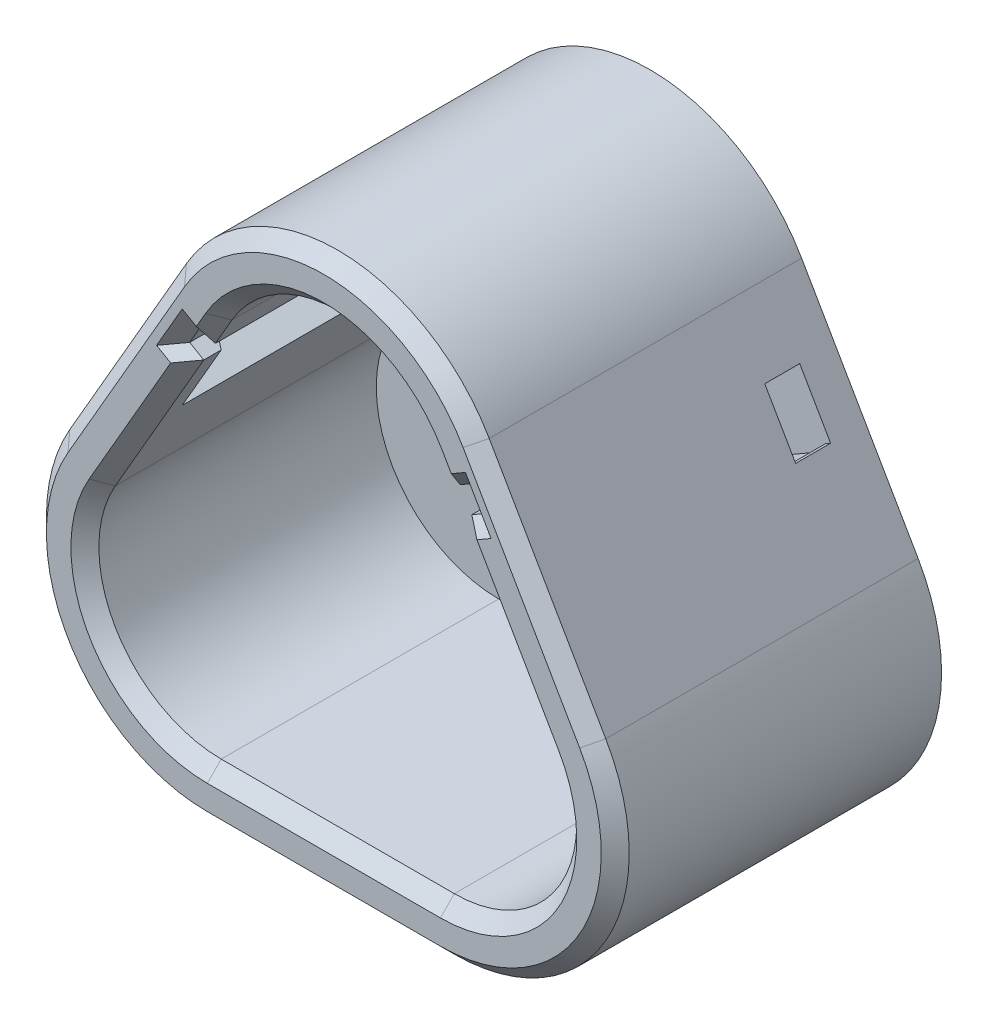
from build123d import *

# Parameters (mm, degrees)
BOSS_EXTRU_1_DEPTH      = 25
ENL_V_MAT_EXTRU_1_DEPTH = 20
ENL_V_MAT_EXTRU_2_DEPTH = 45.21248121115924
ENL_V_MAT_EXTRU_4_DEPTH = 20
ENL_V_MAT_EXTRU_3_DEPTH = 45.21248121115924
CHANFREIN1_SIZE         = 1.2
BOSS_EXTRU_2_START      = 3
BOSS_EXTRU_2_DEPTH      = 3
ENL_V_MAT_EXTRU_5_REACH = 47.001
ESQUISSE7_W             = 1.399999999999995
ESQUISSE7_H             = 20
CHANFREIN2_SIZE2        = 4
CHANFREIN2_SIZE         = 2.309401077
ENL_V_MAT_EXTRU_6_REACH = 60.237
CHANFREIN3_SIZE2        = 4
CHANFREIN3_SIZE         = 2.309401077


with BuildPart() as part:
    # Esquisse1 → Boss.-Extru.1 (new body)
    with BuildSketch(Plane.XY):
        with BuildLine():
            Line((-22.99038105676658, 1.7264973081037391), (-12.990381056766578, 19.047005383792516))
            ThreePointArc((-12.990381056766578, 19.047005383792516), (9.5e-16, 26.547005383792516), (12.990381056766578, 19.047005383792513))
            Line((12.990381056766578, 19.047005383792513), (22.990381056766577, 1.726497308103746))
            ThreePointArc((22.990381056766577, 1.726497308103746), (22.99038105676658, -13.273502691896258), (9.999999999999996, -20.77350269189626))
            Line((9.999999999999996, -20.77350269189626), (-10, -20.773502691896258))
            ThreePointArc((-10, -20.773502691896258), (-22.99038105676658, -13.273502691896255), (-22.99038105676658, 1.7264973081037391))
        make_face()
        with BuildLine():
            Line((-18.66025403784439, -0.7735026918962613), (-8.66025403784439, 16.547005383792516))
            ThreePointArc((-8.66025403784439, 16.547005383792516), (-2.69e-15, 21.547005383792516), (8.660254037844384, 16.547005383792516))
            Line((8.660254037844384, 16.547005383792516), (18.660254037844386, -0.7735026918962474))
            ThreePointArc((18.660254037844386, -0.7735026918962474), (18.660254037844393, -10.773502691896258), (10, -15.773502691896258))
            Line((10, -15.773502691896258), (-10, -15.773502691896258))
            ThreePointArc((-10, -15.773502691896258), (-18.66025403784439, -10.773502691896262), (-18.66025403784439, -0.7735026918962613))
        make_face(mode=Mode.SUBTRACT)
    extrude(amount=BOSS_EXTRU_1_DEPTH)

    # Esquisse2 → Enlèv. mat.-Extru.1 (cut)
    with BuildSketch(Plane.XY.offset(25)):
        Polygon((-10.914359353944898, 12.642780450695335), (-12.300000000000002, 13.442780450695334), (-11.600000000000003, 14.655216015993549), (-10.2143593539449, 13.855216015993548), align=None)
        Polygon((10.214359353944896, 13.855216015993548), (11.6, 14.655216015993549), (12.299999999999999, 13.442780450695334), (10.914359353944896, 12.642780450695334), align=None)
    extrude(amount=-ENL_V_MAT_EXTRU_1_DEPTH, mode=Mode.SUBTRACT)

    # Esquisse3 → Enlèv. mat.-Extru.2 (cut, through all)
    with BuildSketch(Plane.XY.offset(25)):
        Polygon((-10.064359353944898, 14.115023637128878), (-11.709807621135333, 15.06502363712888), (-12.709807621135335, 13.332972829560003), (-11.064359353944898, 12.382972829560003), align=None)
    enl_v_mat_extru_2 = extrude(amount=-ENL_V_MAT_EXTRU_2_DEPTH, mode=Mode.SUBTRACT)

    # Symétrie1: Enlèv. mat.-Extru.2 across plane
    add(enl_v_mat_extru_2.mirror(Plane(origin=(0, 0, 0), x_dir=(0, 0, 1), z_dir=(1, 0, 0))), mode=Mode.SUBTRACT)

    # Esquisse6 → Enlèv. mat.-Extru.4 (cut)
    with BuildSketch(Plane(origin=(0, 0, 0), x_dir=(-1, 0, 0), z_dir=(0, 0, -1))):
        Polygon((11.250000000000002, 12.061433798642659), (15.147114317029969, 14.31143379864266), (18.297114317029976, 8.855473754800698), (14.4, 6.605473754800695), align=None)
        Polygon((-11.249999999999998, 12.061433798642659), (-15.14711431702997, 14.311433798642657), (-18.297114317029973, 8.855473754800693), (-14.399999999999997, 6.605473754800696), align=None)
    extrude(amount=-ENL_V_MAT_EXTRU_4_DEPTH, mode=Mode.SUBTRACT)

    # Esquisse5 → Enlèv. mat.-Extru.3 (cut, through all)
    with BuildSketch(Plane.XY.offset(25)):
        with BuildLine():
            Line((-9.093266739736611, 16.797005383792516), (-10.497372055837118, 14.365023637128878))
            Line((-10.497372055837118, 14.365023637128878), (-11.497372055837118, 12.632972829560003))
            Line((-11.497372055837118, 12.632972829560003), (-19.093266739736613, -0.5235026918962613))
            ThreePointArc((-19.093266739736613, -0.5235026918962613), (-19.09326673973661, -11.023502691896262), (-10.000000000000002, -16.273502691896258))
            Line((-10.000000000000002, -16.273502691896258), (10.000000000000004, -16.273502691896258))
            ThreePointArc((10.000000000000004, -16.273502691896258), (19.09326673973661, -11.023502691896251), (19.093266739736602, -0.523502691896249))
            Line((19.093266739736602, -0.523502691896249), (11.497372055837113, 12.632972829560005))
            Line((11.497372055837113, 12.632972829560005), (10.497372055837118, 14.36502363712888))
            Line((10.497372055837118, 14.36502363712888), (9.0932667397366, 16.797005383792516))
            ThreePointArc((9.0932667397366, 16.797005383792516), (-2.66e-15, 22.047005383792516), (-9.093266739736611, 16.797005383792516))
        make_face()
        with BuildLine():
            Line((-8.66025403784439, 16.547005383792516), (-10.064359353944898, 14.115023637128878))
            Line((-10.064359353944898, 14.115023637128878), (-11.064359353944894, 12.382972829560005))
            Line((-11.064359353944894, 12.382972829560005), (-18.66025403784439, -0.7735026918962613))
            ThreePointArc((-18.66025403784439, -0.7735026918962613), (-18.66025403784439, -10.773502691896262), (-10, -15.773502691896258))
            Line((-10, -15.773502691896258), (10.000000000000002, -15.77350269189626))
            ThreePointArc((10.000000000000002, -15.77350269189626), (18.66025403784439, -10.773502691896255), (18.660254037844386, -0.7735026918962474))
            Line((18.660254037844386, -0.7735026918962474), (11.064359353944898, 12.382972829560003))
            Line((11.064359353944898, 12.382972829560003), (10.064359353944898, 14.115023637128878))
            Line((10.064359353944898, 14.115023637128878), (8.660254037844384, 16.547005383792516))
            ThreePointArc((8.660254037844384, 16.547005383792516), (-2.69e-15, 21.547005383792516), (-8.66025403784439, 16.547005383792516))
        make_face(mode=Mode.SUBTRACT)
    extrude(amount=-ENL_V_MAT_EXTRU_3_DEPTH, mode=Mode.SUBTRACT)

    # Chanfrein1
    chanfrein1_edges = [part.edges().sort_by_distance(p)[0] for p in [
        (22.99038105676658, -13.27350269189626, 25),
        (11.103589838486222, 14.715023637128876, 25),
        (-11.103589838486226, 14.71502363712888, 25),
        (-9.795319397786868, 15.581014510460694, 25),
        (9.795319397786855, 15.581014510460696, 25),
        (-7.11e-15, 22.047005383792516, 25),
        (-15.295319397786866, 6.054735068831872, 25),
        (-19.09326673973661, -11.023502691896262, 25),
        (1.78e-15, -16.273502691896258, 25),
        (19.093266739736606, -11.023502691896253, 25),
        (15.295319397786855, 6.054735068831873, 25),
        (17.990381056766577, 10.386751345948129, 25),
        (2.66e-15, 26.547005383792516, 25),
        (-17.99038105676658, 10.386751345948127, 25),
        (-22.99038105676658, -13.273502691896258, 25),
        (-12.209807621135333, 14.19899823334444, 25),
        (-12.103589838486226, 12.982972829560003, 25),
        (-1.78e-15, -20.77350269189626, 25),
        (12.209807621135335, 14.19899823334444, 25),
        (12.103589838486222, 12.982972829560001, 25),
    ]]
    chamfer(chanfrein1_edges, length=CHANFREIN1_SIZE)

    # Esquisse4 → Boss.-Extru.2 (add)
    with BuildSketch(Plane(origin=(0, 0, 0), x_dir=(-1, 0, 0), z_dir=(0, 0, -1)).offset(BOSS_EXTRU_2_START)):
        with BuildLine():
            Line((22.99038105676658, 1.7264973081037323), (12.990381056766578, 19.047005383792516))
            ThreePointArc((12.990381056766578, 19.047005383792516), (8.9e-16, 26.547005383792513), (-12.990381056766573, 19.047005383792513))
            Line((-12.990381056766573, 19.047005383792513), (-22.990381056766577, 1.726497308103746))
            ThreePointArc((-22.990381056766577, 1.726497308103746), (-22.99038105676658, -13.273502691896255), (-10.000000000000004, -20.773502691896258))
            Line((-10.000000000000004, -20.773502691896258), (9.999999999999996, -20.773502691896258))
            ThreePointArc((9.999999999999996, -20.773502691896258), (22.990381056766577, -13.273502691896262), (22.99038105676658, 1.7264973081037323))
        make_face()
    extrude(amount=-BOSS_EXTRU_2_DEPTH)

    # Esquisse7 → Enlèv. mat.-Extru.5 (cut, up to next)
    with BuildSketch(Plane(origin=(-2.5958946838994956, 4.496221483611885, 0), x_dir=(0.866025403784439, 0.4999999999999994, 0), z_dir=(-0.4999999999999994, 0.866025403784439, 0)), mode=Mode.PRIVATE) as enl_v_mat_extru_5_sk1:
        with Locations((16.973502691896265, -10)):
            Rectangle(ESQUISSE7_W, ESQUISSE7_H)
    enl_v_mat_extru_5_tool1 = extrude(enl_v_mat_extru_5_sk1.sketch, amount=-ENL_V_MAT_EXTRU_5_REACH, mode=Mode.PRIVATE) & part.part
    enl_v_mat_extru_5 = enl_v_mat_extru_5_tool1.solids().sort_by_distance((12.10359, 12.982973, 10))[0]
    add(enl_v_mat_extru_5, mode=Mode.SUBTRACT)

    # Symétrie2: Enlèv. mat.-Extru.5 across plane
    add(enl_v_mat_extru_5.mirror(Plane(origin=(0, 0, 0), x_dir=(0, 0, 1), z_dir=(1, 0, 0))), mode=Mode.SUBTRACT)

    # Chanfrein2
    chanfrein2_edges = [part.edges().sort_by_distance(p)[0] for p in [
        (13.16519237886467, 9.74422329218035, 20),
    ]]
    chanfrein2_side = [part.faces().sort_by_distance(p)[0] for p in [
        (13.16519237886467, 9.74422329218035, 20.04618802153517),
    ]]
    chamfer(chanfrein2_edges, length=CHANFREIN2_SIZE - 0.0001, length2=CHANFREIN2_SIZE2 - 0.0001, reference=chanfrein2_side[0])  # a hair under: the kernel refuses the full size

    # Esquisse8 → Enlèv. mat.-Extru.6 (cut, up to next)
    with BuildSketch(Plane(origin=(17.557368354874363, 10.13675134594814, 0), x_dir=(0, 0, 1), z_dir=(-0.8660254037844385, -0.5000000000000004, 0)), mode=Mode.PRIVATE) as enl_v_mat_extru_6_sk1:
        Polygon((3.0000000000000004, 4.320508075688777), (5.3e-16, 4.320508075688777), (8.7e-16, -0.9794919243112247), (3.000000000000001, -0.9794919243112244), align=None)
    enl_v_mat_extru_6_tool1 = extrude(enl_v_mat_extru_6_sk1.sketch, amount=-ENL_V_MAT_EXTRU_6_REACH, mode=Mode.PRIVATE) & part.part
    enl_v_mat_extru_6 = enl_v_mat_extru_6_tool1.solids().sort_by_distance((16.722114, 11.583454, 1.5))[0]
    add(enl_v_mat_extru_6, mode=Mode.SUBTRACT)

    # Symétrie3: Enlèv. mat.-Extru.6 across plane
    add(enl_v_mat_extru_6.mirror(Plane(origin=(0, 0, 0), x_dir=(0, 0, 1), z_dir=(1, 0, 0))), mode=Mode.SUBTRACT)

    # Chanfrein3
    chanfrein3_edges = [part.edges().sort_by_distance(p)[0] for p in [
        (-13.16519237886467, 9.74422329218035, 20),
    ]]
    chanfrein3_side = [part.faces().sort_by_distance(p)[0] for p in [
        (-13.16519237886467, 9.74422329218035, 20.04618802153517),
    ]]
    chamfer(chanfrein3_edges, length=CHANFREIN3_SIZE - 0.0001, length2=CHANFREIN3_SIZE2 - 0.0001, reference=chanfrein3_side[0])  # a hair under: the kernel refuses the full size


solid = part.part
